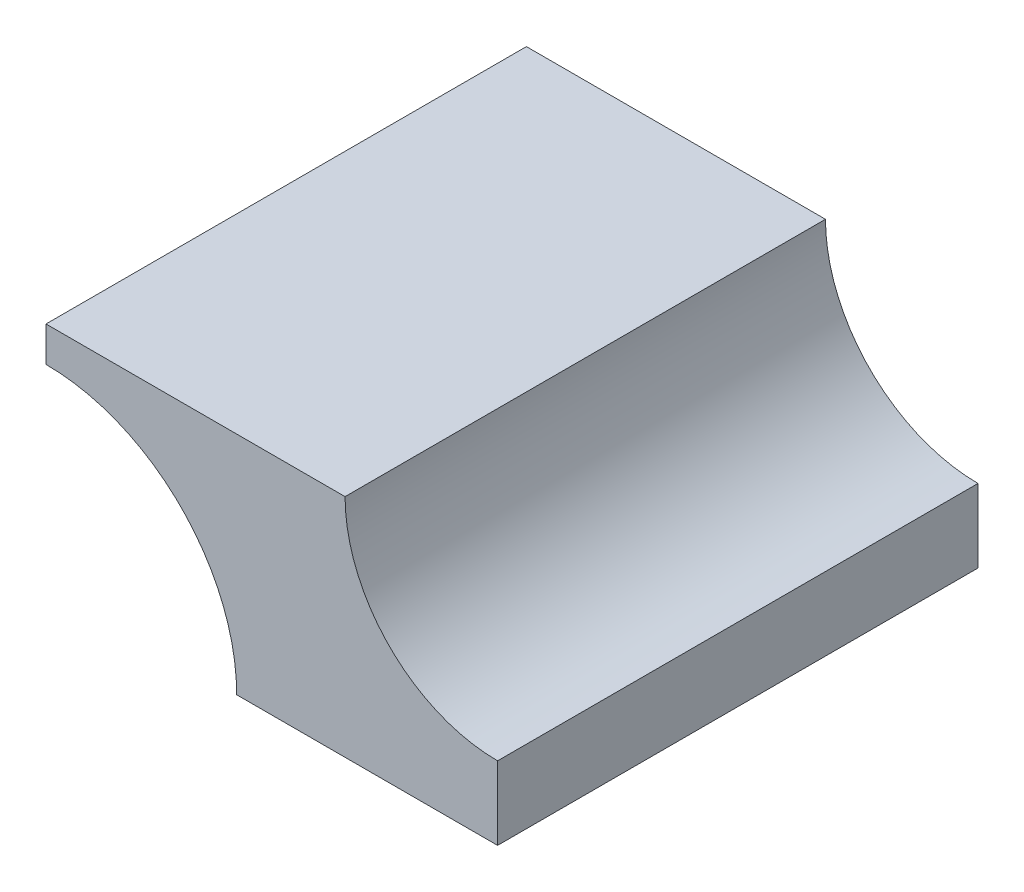
from build123d import *

# Parameters (mm, degrees)
BOSS_EXTRUDE1_DEPTH = 20


with BuildPart() as part:
    # Sketch1 → Boss-Extrude1 (new body)
    with BuildSketch(Plane.XY):
        with BuildLine():
            Line((7.94, 0), (18.8, 0))
            Line((18.8, 0), (18.8, 3.05))
            ThreePointArc((18.8, 3.05), (14.309871939, 4.909871939), (12.45, 9.4))
            Line((12.45, 9.4), (0, 9.4))
            Line((0, 9.4), (0, 7.94))
            ThreePointArc((0, 7.94), (5.614427843, 5.614427843), (7.94, 0))
        make_face()
    extrude(amount=BOSS_EXTRUDE1_DEPTH)


solid = part.part
